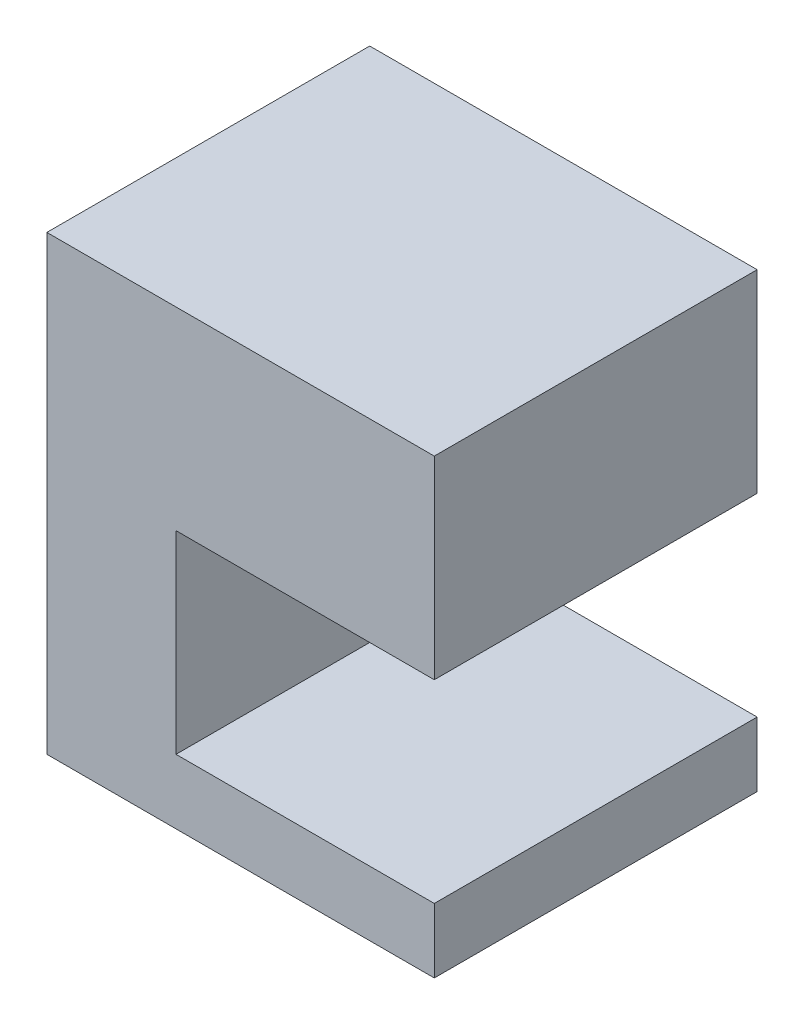
from build123d import *

# Parameters (mm, degrees)
BOSS_EXTRUDE1_DEPTH = 5


with BuildPart() as part:
    # Sketch1 → Boss-Extrude1 (new body)
    with BuildSketch(Plane.XY):
        Polygon((6, 7), (0, 7), (0, 0), (6, 0), (6, 1), (2, 1), (2, 4), (6, 4), align=None)
    extrude(amount=BOSS_EXTRUDE1_DEPTH)


solid = part.part
